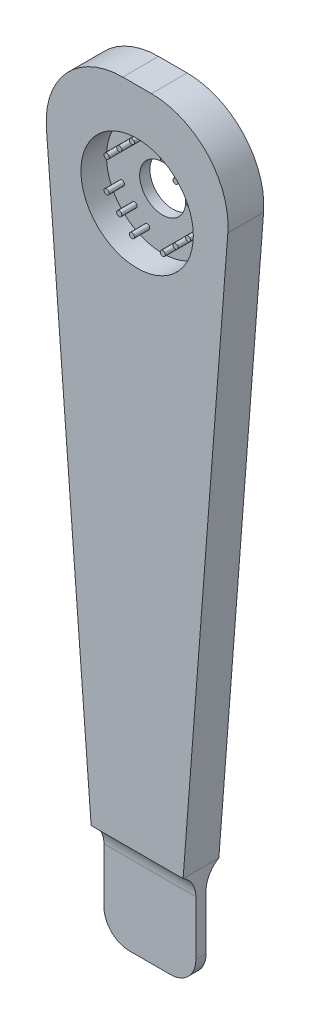
from build123d import *

# Parameters (mm, degrees)
ESQUISSE1_R             = 4.5
ESQUISSE1_W             = 18
ESQUISSE1_H             = 20
BOSS_EXTRU_1_DEPTH      = 7
ESQUISSE2_R             = 11
ENL_V_MAT_EXTRU_1_DEPTH = 5
ESQUISSE3_R             = 0.5
BOSS_EXTRU_2_DEPTH      = 3
ESQUISSE4_W             = 18
ESQUISSE4_H             = 20
ENL_V_MAT_EXTRU_2_DEPTH = 2.5
ESQUISSE5_W             = 18
ESQUISSE5_H             = 20
ENL_V_MAT_EXTRU_3_DEPTH = 2.5
CONG_1_R                = 5
CONG_2_R                = 15


with BuildPart() as part:
    # Esquisse1 → Boss.-Extru.1 (new body)
    # profile 1 of 2: a face of its own
    with BuildSketch(Plane.XY):
        Polygon((18, 20), (28, 150), (18, 150), (0, 150), (-10, 150), (0, 20), align=None)
        with Locations((9, 130)):
            Circle(ESQUISSE1_R, mode=Mode.SUBTRACT)
    # profile 2 of 2: a face of its own
    with BuildSketch(Plane.XY):
        with Locations((9, 10)):
            Rectangle(ESQUISSE1_W, ESQUISSE1_H)
    extrude(amount=BOSS_EXTRU_1_DEPTH)

    # Esquisse2 → Enlèv. mat.-Extru.1 (cut)
    with BuildSketch(Plane.XY.offset(7)):
        with Locations((9, 130)):
            Circle(ESQUISSE2_R)
    extrude(amount=-ENL_V_MAT_EXTRU_1_DEPTH, mode=Mode.SUBTRACT)

    # Esquisse3 → Boss.-Extru.2 (add)
    with BuildSketch(Plane.XY.offset(2)):
        with Locations((3.5, 135.5)):
            Circle(ESQUISSE3_R)
        with Locations((5.974873734, 137.974873734)):
            Circle(ESQUISSE3_R)
        with Locations((1.025126266, 133.025126266)):
            Circle(ESQUISSE3_R)
        with Locations((1.025126266, 126.974873734)):
            Circle(ESQUISSE3_R)
        with Locations((3.5, 124.5)):
            Circle(ESQUISSE3_R)
        with Locations((5.974873734, 122.025126266)):
            Circle(ESQUISSE3_R)
        with Locations((12.025126266, 122.025126266)):
            Circle(ESQUISSE3_R)
        with Locations((14.5, 124.5)):
            Circle(ESQUISSE3_R)
        with Locations((16.974873734, 126.974873734)):
            Circle(ESQUISSE3_R)
        with Locations((16.974873734, 133.025126266)):
            Circle(ESQUISSE3_R)
        with Locations((14.5, 135.5)):
            Circle(ESQUISSE3_R)
        with Locations((12.025126266, 137.974873734)):
            Circle(ESQUISSE3_R)
    extrude(amount=BOSS_EXTRU_2_DEPTH)

    # Esquisse4 → Enlèv. mat.-Extru.2 (cut)
    with BuildSketch(Plane.XY.offset(7)):
        with Locations((9, 10)):
            Rectangle(ESQUISSE4_W, ESQUISSE4_H)
    extrude(amount=-ENL_V_MAT_EXTRU_2_DEPTH, mode=Mode.SUBTRACT)

    # Esquisse5 → Enlèv. mat.-Extru.3 (cut)
    with BuildSketch(Plane(origin=(0, 0, 0), x_dir=(-1, 0, 0), z_dir=(0, 0, -1))):
        with Locations((-9, 10)):
            Rectangle(ESQUISSE5_W, ESQUISSE5_H)
    extrude(amount=-ENL_V_MAT_EXTRU_3_DEPTH, mode=Mode.SUBTRACT)

    # Congé1
    # the kernel refuses this fillet: 5 mm, written as the material it adds along each edge
    with BuildSketch(Plane(origin=(0, 20, 2.5), x_dir=(0, 0, -1), z_dir=(1, 0, 0)), Plane(origin=(18, 20, 4.5), x_dir=(0, 0, 1), z_dir=(-1, 0, 0))) as cong_1_piece_1:
        with BuildLine():
            CenterArc((5, -4.330127019), CONG_1_R, 120, 60)
            Line((0, -4.330127019), (0, 0))
            Line((0, 0), (2.5, 0))
        make_face()
    extrude(amount=18)
    # the kernel refuses this fillet: 5 mm, written as the material it takes off along each edge
    with BuildSketch(Plane(origin=(18, 0, -10), x_dir=(-1, 0, 0), z_dir=(0, 0, 1)), Plane(origin=(0, 0, -10), x_dir=(0, 1, 0), z_dir=(0, 0, 1))) as cong_1_2_piece_1:
        with BuildLine():
            CenterArc((CONG_1_R, -CONG_1_R), CONG_1_R, 90, 90)
            Line((0, -CONG_1_R), (0, 0))
            Line((0, 0), (CONG_1_R, 0))
        make_face()
    extrude(amount=27, mode=Mode.SUBTRACT)

    # Congé2
    cong_2_edges = [part.edges().sort_by_distance(p)[0] for p in [
        (-10, 150, 3.5),
        (28, 150, 3.5),
    ]]
    fillet(cong_2_edges, radius=CONG_2_R)


solid = part.part
